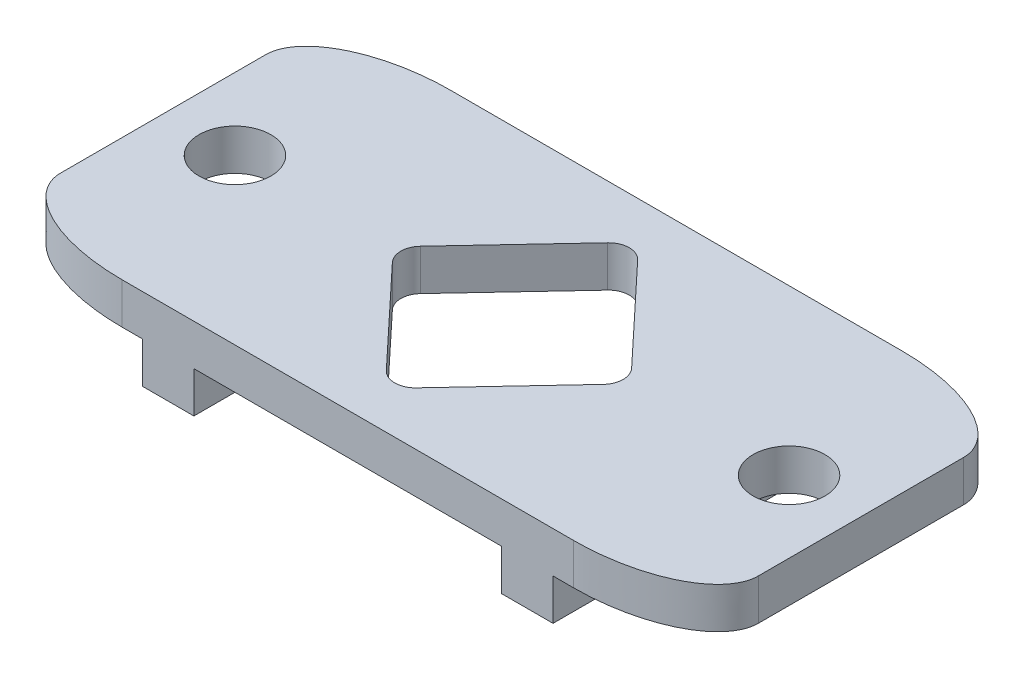
from build123d import *

# Parameters (mm, degrees)
SKETCH1_W           = 34
SKETCH1_H           = 16
SKETCH1_R           = 1.75
BOSS_EXTRUDE1_DEPTH = 2
SKETCH1_3_W         = 2.5
SKETCH1_3_H         = 16
BOSS_EXTRUDE2_DEPTH = 2
CUT_EXTRUDE2_DEPTH  = 19.894443628
FILLET1_SIZE        = 6
FILLET1_SIZE_2      = 3
FILLET2_SIZE        = 6
FILLET2_SIZE_2      = 3


with BuildPart() as part:
    # Sketch1 → Boss-Extrude1 (new body)
    with BuildSketch(Plane(origin=(0, 0, 0), x_dir=(1, 0, 0), z_dir=(0, 1, 0))):
        Rectangle(SKETCH1_W, SKETCH1_H)
        with Locations(Location((-13.5, 0, 0), (0, 0, 270))):
            Circle(SKETCH1_R, mode=Mode.SUBTRACT)
        with Locations(Location((13.5, 0, 0), (0, 0, 270))):
            Circle(SKETCH1_R, mode=Mode.SUBTRACT)
    extrude(amount=BOSS_EXTRUDE1_DEPTH)

    # Sketch1<3> → Boss-Extrude2 (add)
    with BuildSketch(Plane(origin=(0, 0, 0), x_dir=(1, 0, 0), z_dir=(0, 1, 0))):
        with Locations((-8.75, 0)):
            Rectangle(SKETCH1_3_W, SKETCH1_3_H)
        with Locations((8.75, 0)):
            Rectangle(SKETCH1_3_W, SKETCH1_3_H)
    extrude(amount=-BOSS_EXTRUDE2_DEPTH)

    # Sketch2 → Cut-Extrude2 (cut, through all)
    with BuildSketch(Plane.XZ):
        with BuildLine():
            ThreePointArc((-5.145390176, -0.683941129), (-5.415852972, 0), (-5.145390176, 0.683941129))
            Line((-5.145390176, 0.683941129), (-0.729537204, 5.394184299))
            ThreePointArc((-0.729537204, 5.394184299), (0, 5.71024317), (0.729537204, 5.394184299))
            Line((0.729537204, 5.394184299), (5.145390176, 0.683941129))
            ThreePointArc((5.145390176, 0.683941129), (5.415852972, 0), (5.145390176, -0.683941129))
            Line((5.145390176, -0.683941129), (0.729537204, -5.394184299))
            ThreePointArc((0.729537204, -5.394184299), (0, -5.71024317), (-0.729537204, -5.394184299))
            Line((-0.729537204, -5.394184299), (-5.145390176, -0.683941129))
        make_face()
    extrude(amount=-CUT_EXTRUDE2_DEPTH, mode=Mode.SUBTRACT)

    # Fillet1
    # an asymmetric fillet: 6, 3 mm, written as the material it takes off along each edge
    with BuildSketch(Plane(origin=(17, -15, 8), x_dir=(-1, 0, 0), z_dir=(0, 1, 0))) as fillet1_piece_1:
        with BuildLine():
            Bezier((FILLET1_SIZE, 0), (0, 0), (0, -FILLET1_SIZE_2), weights=[1, 0.707106781, 1])
            Line((0, -FILLET1_SIZE_2), (0, 0))
            Line((0, 0), (FILLET1_SIZE, 0))
        make_face()
    extrude(amount=32, mode=Mode.SUBTRACT)
    with BuildSketch(Plane(origin=(-17, -15, -8), x_dir=(0, 0, 1), z_dir=(0, 1, 0))) as fillet1_piece_2:
        with BuildLine():
            Bezier((FILLET1_SIZE_2, 0), (0, 0), (0, FILLET1_SIZE), weights=[1, 0.707106781, 1])
            Line((0, FILLET1_SIZE), (0, 0))
            Line((0, 0), (FILLET1_SIZE_2, 0))
        make_face()
    extrude(amount=32, mode=Mode.SUBTRACT)

    # Fillet2
    # an asymmetric fillet: 6, 3 mm, written as the material it takes off along each edge
    with BuildSketch(Plane(origin=(17, -15, -8), x_dir=(-1, 0, 0), z_dir=(0, 1, 0)), Plane(origin=(-17, -15, 8), x_dir=(1, 0, 0), z_dir=(0, 1, 0))) as fillet2_piece_1:
        with BuildLine():
            Bezier((FILLET2_SIZE, 0), (0, 0), (0, FILLET2_SIZE_2), weights=[1, 0.707106781, 1])
            Line((0, FILLET2_SIZE_2), (0, 0))
            Line((0, 0), (FILLET2_SIZE, 0))
        make_face()
    extrude(amount=32, mode=Mode.SUBTRACT)


solid = part.part
